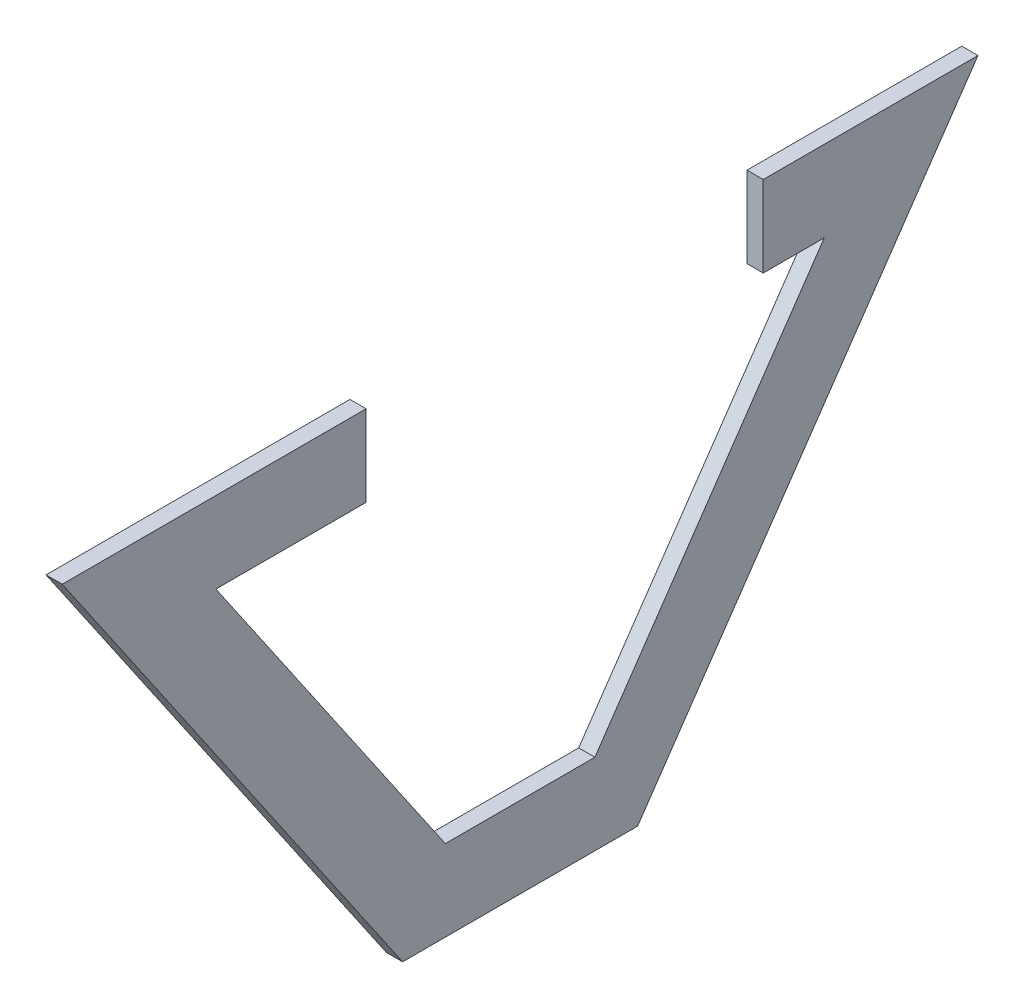
from build123d import *

# Parameters (mm, degrees)
BASE_FLANGE1_DEPTH = 2
SKETCH6_W          = 49
SKETCH6_H          = 16.635259071
CUT_EXTRUDE1_DEPTH = 49


# Sheet-metal steps are written as plain solids
with BuildPart() as part:
    # Sketch1 → Base-Flange1 (new body)
    with BuildSketch(Plane(origin=(0, 0, 0), x_dir=(0, 0, -1), z_dir=(1, 0, 0))):
        Polygon((-14.5, -22.025862069), (14.5, -22.025862069), (56.5, 39.324712644), (-56.5, 39.324712644), align=None)
        Polygon((-9.227058078, -12.025862069), (9.227058078, -12.025862069), (37.5352548, 29.324712644), (-37.5352548, 29.324712644), align=None, mode=Mode.SUBTRACT)
    extrude(amount=-BASE_FLANGE1_DEPTH)

    # Sketch6 → Cut-Extrude1 (cut)
    with BuildSketch(Plane(origin=(0, 0, 0), x_dir=(0, 0, -1), z_dir=(1, 0, 0))):
        with Locations((5.5, 37.409748974)):
            Rectangle(SKETCH6_W, SKETCH6_H)
    extrude(amount=-CUT_EXTRUDE1_DEPTH, mode=Mode.SUBTRACT)


solid = part.part
